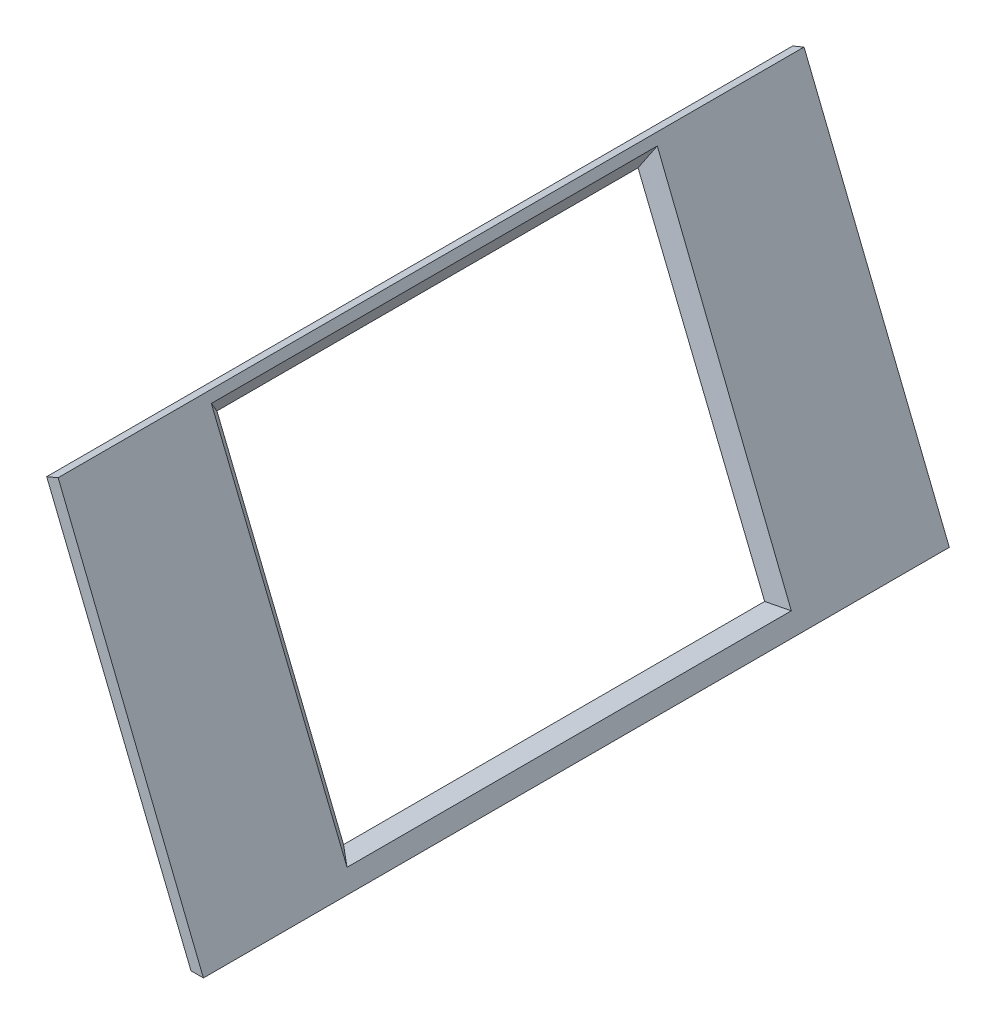
from build123d import *

# Parameters (mm, degrees)
BOSS_EXTRU_1_DEPTH      = 600
ESQUISSE2_W             = 338.746
ESQUISSE2_H             = 271
ENL_V_MAT_EXTRU_1_DEPTH = 10
ENL_V_MAT_EXTRU_1_DRAFT = 45


with BuildPart() as part:
    # Esquisse1 → Boss.-Extru.1 (new body)
    with BuildSketch(Plane.XY):
        Polygon((219.734545737, 127.183031526), (103.65574387, 413.400422848), (112.874448857, 417.275403928), (229.734545737, 127.183031526), align=None)
    extrude(amount=BOSS_EXTRU_1_DEPTH)


with BuildPart() as enl_v_mat_extru_1_tool:
    # Esquisse2 → Enlèv. mat.-Extru.1 (with draft: the straight prism first)
    with BuildSketch(Plane(origin=(232.992448308, 94.492805342, 0), x_dir=(0, 0, 1), z_dir=(-0.926688841813853, -0.3758294699164765, 0))):
        with Locations((300.232670333, 191.187948379)):
            Rectangle(ESQUISSE2_W, ESQUISSE2_H)
    extrude(amount=-ENL_V_MAT_EXTRU_1_DEPTH)
    # Enlèv. mat.-Extru.1: the draft: its side faces are tilted about the plane it starts from
    enl_v_mat_extru_1_sides = [enl_v_mat_extru_1_tool.faces().sort_by_distance(p)[0] for p in [
        (165.771827223, 273.543691144, 130.859670333),
        (216.696720397, 147.977353078, 300.232670333),
        (165.771827223, 273.543691144, 469.605670333),
        (114.846934049, 399.11002921, 300.232670333),
    ]]
    draft(enl_v_mat_extru_1_sides, Plane(origin=(232.992448308, 94.492805342, 0), x_dir=(0, 0, 1), z_dir=(-0.926688841813853, -0.3758294699164765, 0)), ENL_V_MAT_EXTRU_1_DRAFT)


with BuildPart() as part_1:
    add(part.part)

    # Enlèv. mat.-Extru.1: cut by enl_v_mat_extru_1_tool
    add(enl_v_mat_extru_1_tool.part, mode=Mode.SUBTRACT)


solid = part_1.part
